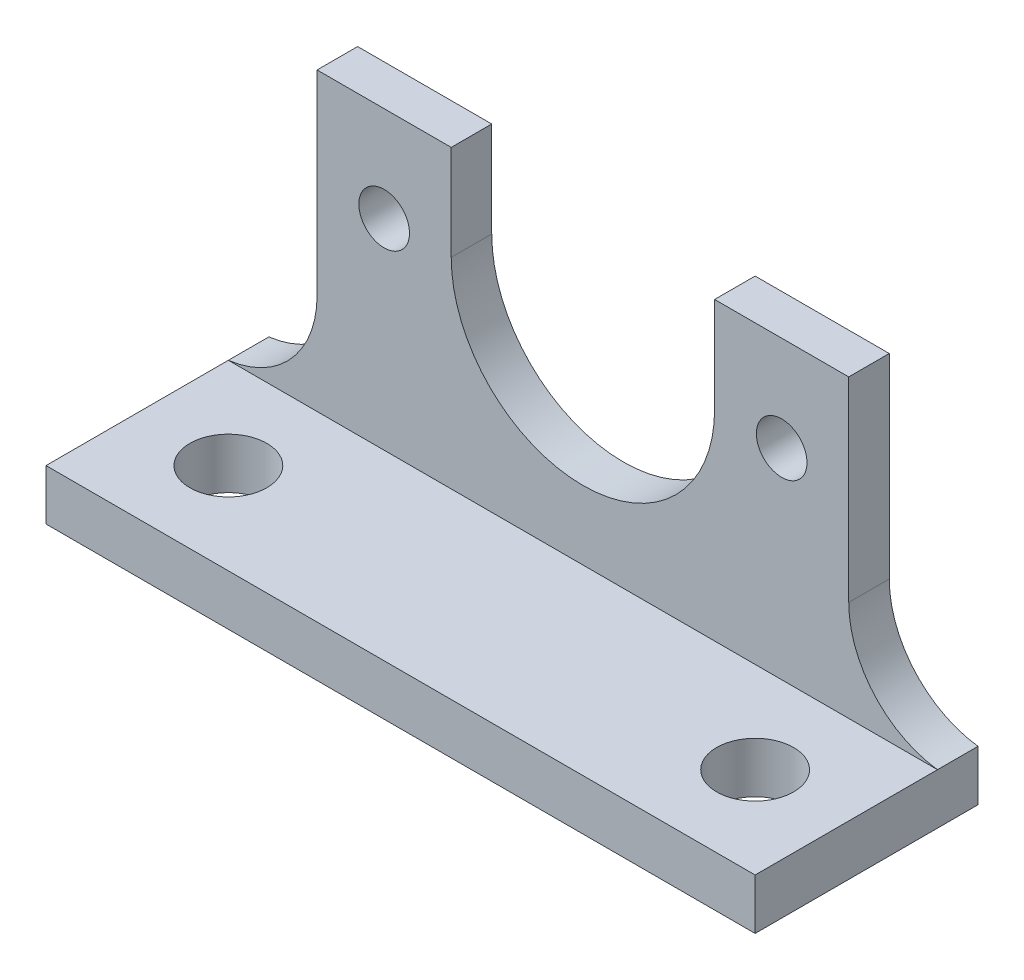
from build123d import *

# Parameters (mm, degrees)
SKETCH1_R                = 1.5875
BOSS_EXTRUDE1_DEPTH      = 2.54
BOSS_EXTRUDE2_DEPTH      = 11.43
BOSS_EXTRUDE2_DEPTH_BACK = 2.54
SKETCH2_W                = 44.45
SKETCH2_H                = 3.175
SKETCH3_R                = 2.413
CUT_EXTRUDE1_DEPTH       = 33.139163755
FILLET1_R                = 6.35


with BuildPart() as part:
    # Sketch1 → Boss-Extrude1 (new body)
    with BuildSketch(Plane.XY):
        with BuildLine():
            Line((-8.255, -5.230769231), (-8.255, 0.738461538))
            Line((-8.255, 0.738461538), (-16.6624, 0.738461538))
            Line((-16.6624, 0.738461538), (-16.6624, -5.230769231))
            Line((-16.6624, -5.230769231), (-16.6624, -20.978769231))
            Line((-16.6624, -20.978769231), (16.6624, -20.978769231))
            Line((16.6624, -20.978769231), (16.6624, -5.230769231))
            Line((16.6624, -5.230769231), (16.6624, 0.738461538))
            Line((16.6624, 0.738461538), (8.255, 0.738461538))
            Line((8.255, 0.738461538), (8.255, -5.230769231))
            ThreePointArc((8.255, -5.230769231), (0, -13.485769231), (-8.255, -5.230769231))
        make_face()
        with Locations((-12.4587, -5.230769231)):
            Circle(SKETCH1_R, mode=Mode.SUBTRACT)
        with Locations(Location((12.4587, -5.230769231, 0), (0, 0, 180))):
            Circle(SKETCH1_R, mode=Mode.SUBTRACT)
    extrude(amount=BOSS_EXTRUDE1_DEPTH)

    # Sketch2 → Boss-Extrude2 (add, two sides: drawn at the far end of the back side and taken through both)
    with BuildSketch(Plane.XY.offset(2.54).offset(-BOSS_EXTRUDE2_DEPTH_BACK)):
        with Locations((0, -19.391269231)):
            Rectangle(SKETCH2_W, SKETCH2_H)
    extrude(amount=BOSS_EXTRUDE2_DEPTH + BOSS_EXTRUDE2_DEPTH_BACK)

    # Sketch3 → Cut-Extrude1 (cut, through all)
    with BuildSketch(Plane(origin=(0, -17.803769231, 0), x_dir=(1, 0, 0), z_dir=(0, 1, 0))):
        with Locations(Location((-16.51, -8.255, 0), (0, 0, 270))):
            Circle(SKETCH3_R)
        with Locations(Location((16.51, -8.255, 0), (0, 0, 90))):
            Circle(SKETCH3_R)
    extrude(amount=-CUT_EXTRUDE1_DEPTH, mode=Mode.SUBTRACT)

    # Fillet1
    # the kernel refuses this fillet: 6.35 mm, written as the material it adds along each edge
    with BuildSketch(Plane(origin=(-16.6624, -17.803769231, 2.54), x_dir=(0, 1, 0), z_dir=(0, 0, -1))) as fillet1_piece_1:
        with BuildLine():
            CenterArc((6.300992084, -6.35), FILLET1_R, 90, 82.87698928)
            Line((0, -5.5626), (-0.126019842, -5.546852))
            ThreePointArc((-0.126019842, -5.546852), (-0.127, -2.7813), (-0.127, 0))
            Line((-0.127, 0), (0, 0.127))
            Line((0, 0.127), (6.300992084, 0.127))
            Line((6.300992084, 0.127), (6.300992084, 0))
        make_face()
    extrude(amount=2.54)
    with BuildSketch(Plane(origin=(16.6624, -17.803769231, 0), x_dir=(1, 0, 0), z_dir=(0, 0, 1))) as fillet1_piece_2:
        with BuildLine():
            CenterArc((6.35, 6.300992084), FILLET1_R, 180, 82.87698928)
            Line((0, 6.300992084), (-0.127, 6.300992084))
            Line((-0.127, 6.300992084), (-0.127, 0))
            Line((-0.127, 0), (0, -0.127))
            ThreePointArc((0, -0.127), (2.7813, -0.127), (5.546852, -0.126019842))
            Line((5.546852, -0.126019842), (5.5626, 0))
        make_face()
    extrude(amount=2.54)


solid = part.part
